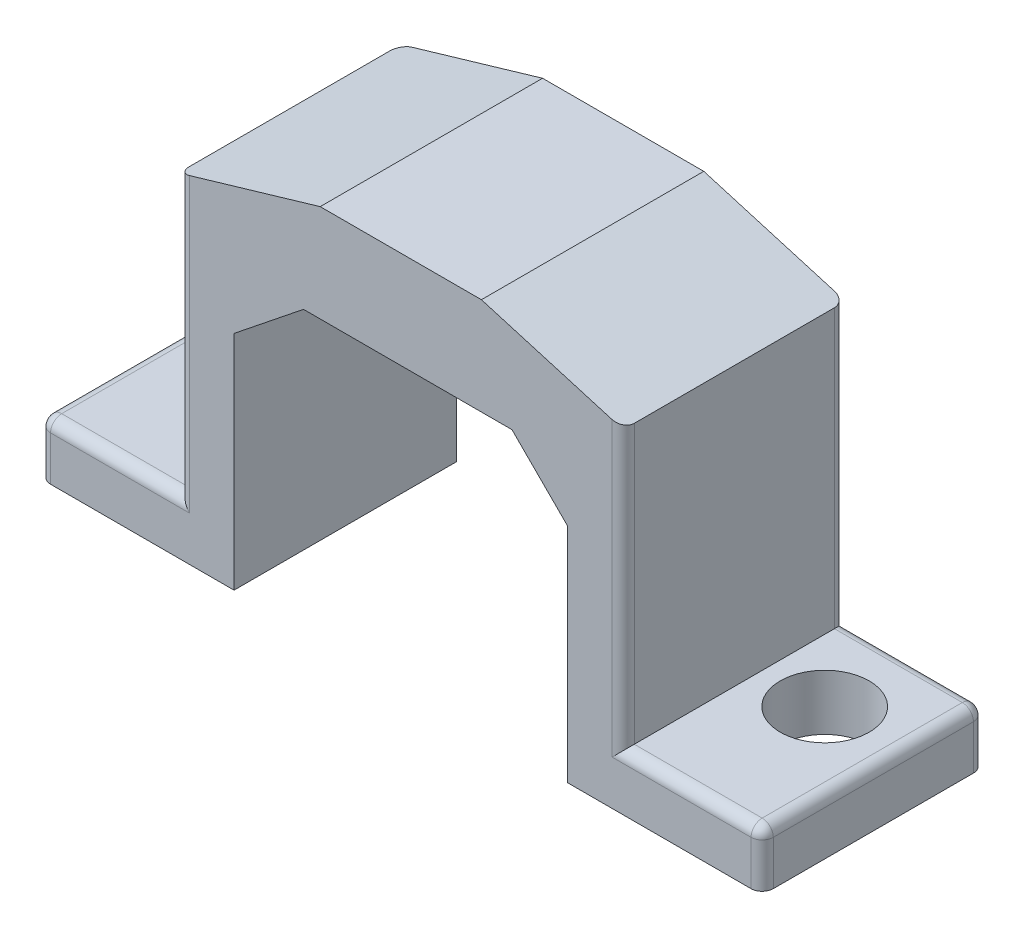
from build123d import *

# Parameters (mm, degrees)
GRUNDK_RPER_DEPTH              = 8
SKIZZE4_R                      = 1.6
SCHRAUBEN_BOHRUNG_DEPTH        = 3
VERRUNDUNG1_R                  = 0.4
DREIECKE_SEITLICH_HALTER_DEPTH = 0.75


with BuildPart() as part:
    # Skizze1 → Grundkörper (new body)
    with BuildSketch(Plane.XY):
        Polygon((0, 0), (7, 0), (7, 10), (19, 10), (19, 0), (26, 0), (26, 2), (21, 2), (21, 12), (15.9, 13.5), (10.1, 13.5), (5, 12), (5, 2), (0, 2), align=None)
    extrude(amount=GRUNDK_RPER_DEPTH)

    # Skizze4 → Schrauben-Bohrung (cut)
    with BuildSketch(Plane.XZ):
        with Locations((23.25, 3)):
            Circle(SKIZZE4_R)
    schrauben_bohrung = extrude(amount=-SCHRAUBEN_BOHRUNG_DEPTH, mode=Mode.SUBTRACT)

    # Verrundung1
    verrundung1_edges = [part.edges().sort_by_distance(p)[0] for p in [
        (23.5, 2, 0),
        (23.5, 2, 8),
        (2.5, 2, 0),
        (2.5, 2, 8),
        (5, 7, 8),
        (5, 7, 0),
        (21, 7, 8),
        (21, 7, 0),
        (26, 1, 0),
        (26, 1, 8),
        (26, 2, 4),
        (0, 2, 4),
        (0, 1, 8),
    ]]
    fillet(verrundung1_edges, radius=VERRUNDUNG1_R)

    # Skizze8 → Dreiecke_seitlich_Halter (add)
    with BuildSketch(Plane.XY.offset(8)):
        Polygon((9.5, 10), (7, 8), (7, 10), align=None)
        Polygon((17, 10), (19, 10), (19, 8), align=None)
    dreiecke_seitlich_halter = extrude(amount=-DREIECKE_SEITLICH_HALTER_DEPTH)

    # Spiegeln_seitlich_Halter: Dreiecke_seitlich_Halter across plane
    add(dreiecke_seitlich_halter.mirror(Plane.XY.offset(5)))

    # Spiegeln5: Schrauben-Bohrung across plane
    add(schrauben_bohrung.mirror(Plane(origin=(13, 0, 0), x_dir=(0, 0, 1), z_dir=(1, 0, 0))), mode=Mode.SUBTRACT)


solid = part.part
